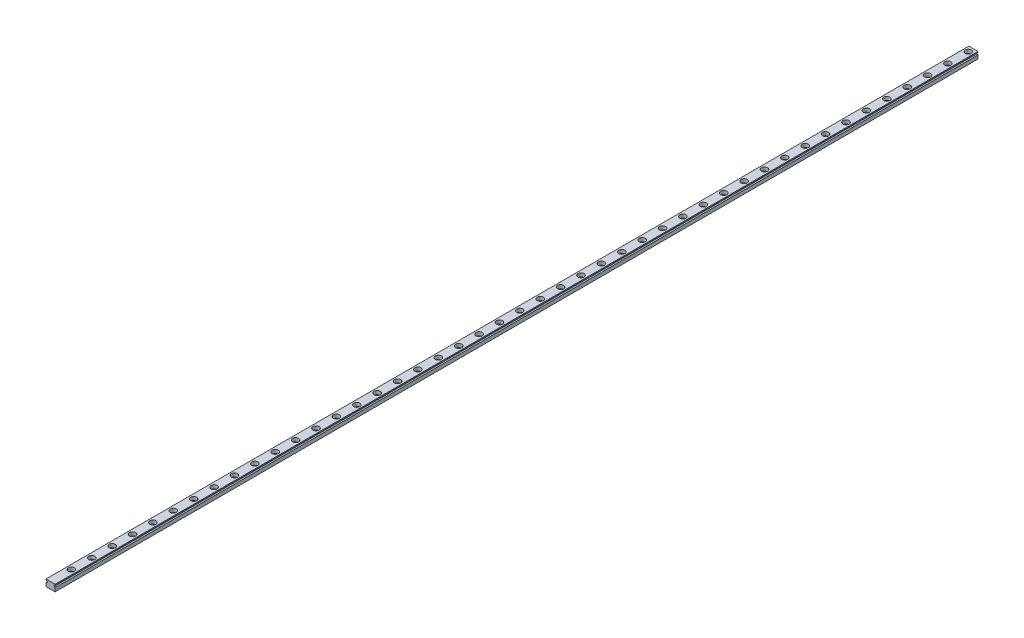
from build123d import *

# Parameters (mm, degrees)
EXTRUDE1_DEPTH  = 905.4
SKETCH2_R       = 3
EXTRUDE2_DEPTH  = 3.5
SKETCH_R        = 1.75
EXTRUDE3_DEPTH  = 906.434514474
LPATTERN1_COUNT = 45
LPATTERN1_PITCH = 20


with BuildPart() as part:
    # Sketch1 → Extrude1 (new body)
    with BuildSketch(Plane.XY):
        with BuildLine():
            Line((-4.5, -3.25), (4.5, -3.25))
            Line((4.5, -3.25), (4.5, 0.25))
            ThreePointArc((4.5, 0.25), (3.93077967, 0.427814974), (3.563991137, 0.898023568))
            Line((3.563991137, 0.898023568), (3.235073025, 0.898023568))
            Line((3.235073025, 0.898023568), (3.235073025, 1.601976432))
            Line((3.235073025, 1.601976432), (3.563991137, 1.601976432))
            ThreePointArc((3.563991137, 1.601976432), (3.93077967, 2.072185026), (4.5, 2.25))
            Line((4.5, 2.25), (4.5, 3.25))
            Line((4.5, 3.25), (-4.5, 3.25))
            Line((-4.5, 3.25), (-4.5, 2.25))
            ThreePointArc((-4.5, 2.25), (-3.93077967, 2.072185026), (-3.563991137, 1.601976432))
            Line((-3.563991137, 1.601976432), (-3.235073025, 1.601976432))
            Line((-3.235073025, 1.601976432), (-3.235073025, 0.898023568))
            Line((-3.235073025, 0.898023568), (-3.563991137, 0.898023568))
            ThreePointArc((-3.563991137, 0.898023568), (-3.93077967, 0.427814974), (-4.5, 0.25))
            Line((-4.5, 0.25), (-4.5, -3.25))
        make_face()
    extrude(amount=EXTRUDE1_DEPTH)

    # Sketch2 → Extrude2 (cut)
    with BuildSketch(Plane(origin=(0, 3.25, 0), x_dir=(1, 0, 0), z_dir=(0, 1, 0))):
        with Locations((0, -5)):
            Circle(SKETCH2_R)
    extrude2 = extrude(amount=-EXTRUDE2_DEPTH, mode=Mode.SUBTRACT)

    # Sketch → Extrude3 (cut, through all)
    with BuildSketch(Plane(origin=(0, 3.25, 0), x_dir=(1, 0, 0), z_dir=(0, 1, 0))):
        with Locations((0, -5)):
            Circle(SKETCH_R)
    extrude3 = extrude(amount=-EXTRUDE3_DEPTH, mode=Mode.SUBTRACT)

    # LPattern1: Extrude2, Extrude3 ×45
    with Locations(*[(0, 0, i * LPATTERN1_PITCH) for i in range(1, LPATTERN1_COUNT)]):
        add(extrude2, mode=Mode.SUBTRACT)
        add(extrude3, mode=Mode.SUBTRACT)


solid = part.part
